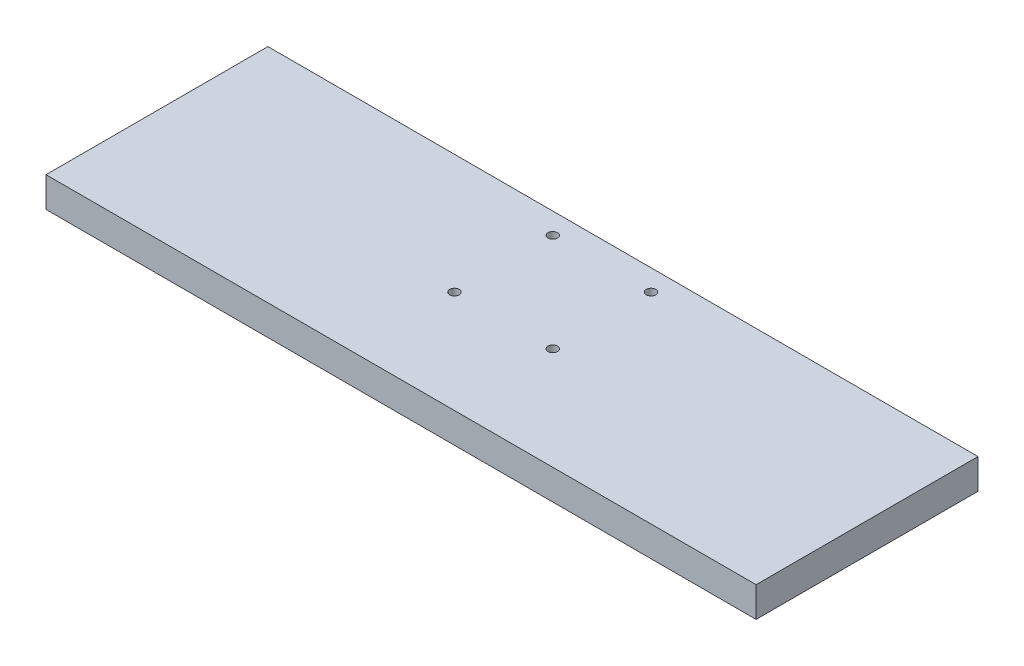
from build123d import *

# Parameters (mm, degrees)
SKETCH_2_W          = 224
SKETCH_2_H          = 70
EXTRUDE_1_DEPTH     = 9.5
SKETCH_4_R          = 1.5
CUT_EXTRUDE_1_DEPTH = 118.725315884


with BuildPart() as part:
    # 草图2 → 凸台-拉伸1 (new body)
    with BuildSketch(Plane(origin=(0, 0, 0), x_dir=(1, 0, 0), z_dir=(0, 1, 0))):
        Rectangle(SKETCH_2_W, SKETCH_2_H)
    extrude(amount=EXTRUDE_1_DEPTH)

    # 草图4 → 切除-拉伸1 (cut, through all)
    with BuildSketch(Plane(origin=(0, 9.5, 0), x_dir=(1, 0, 0), z_dir=(0, 1, 0))):
        with Locations((15.5, -2.65)):
            Circle(SKETCH_4_R)
        with Locations((-15.5, -2.65)):
            Circle(SKETCH_4_R)
        with Locations((15.5, 28.35)):
            Circle(SKETCH_4_R)
        with Locations((-15.5, 28.35)):
            Circle(SKETCH_4_R)
    extrude(amount=-CUT_EXTRUDE_1_DEPTH, mode=Mode.SUBTRACT)


solid = part.part
